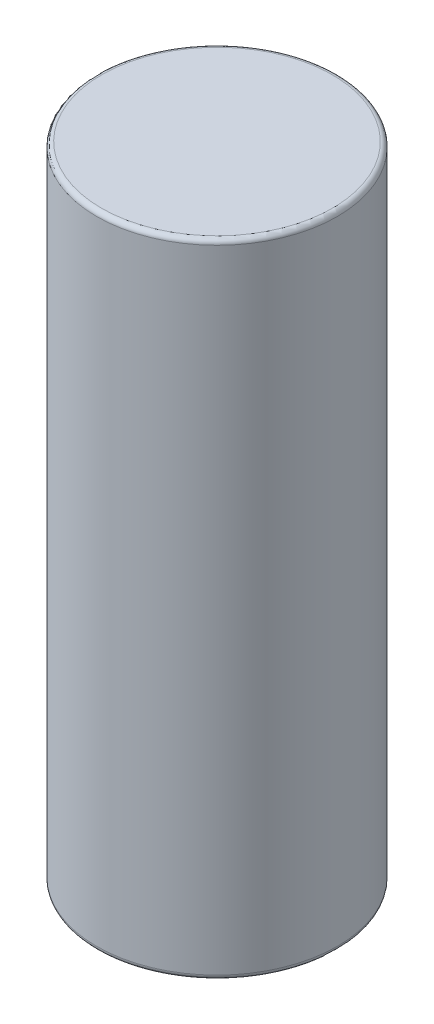
from build123d import *

# Parameters (mm, degrees)
SKETCH1_W = 75
SKETCH1_H = 400
FILLET1_R = 3


with BuildPart() as part:
    # Sketch1 → Revolve1 (revolve)
    with BuildSketch(Plane.XY):
        with Locations((37.5, 0)):
            Rectangle(SKETCH1_W, SKETCH1_H)
    revolve(axis=Axis((0, 0, 0), (0, 1, 0)))

    # Fillet1
    fillet1_edges = [part.edges().sort_by_distance(p)[0] for p in [
        (-75, -200, 0),
        (-75, 200, 0),
    ]]
    fillet(fillet1_edges, radius=FILLET1_R)


solid = part.part
